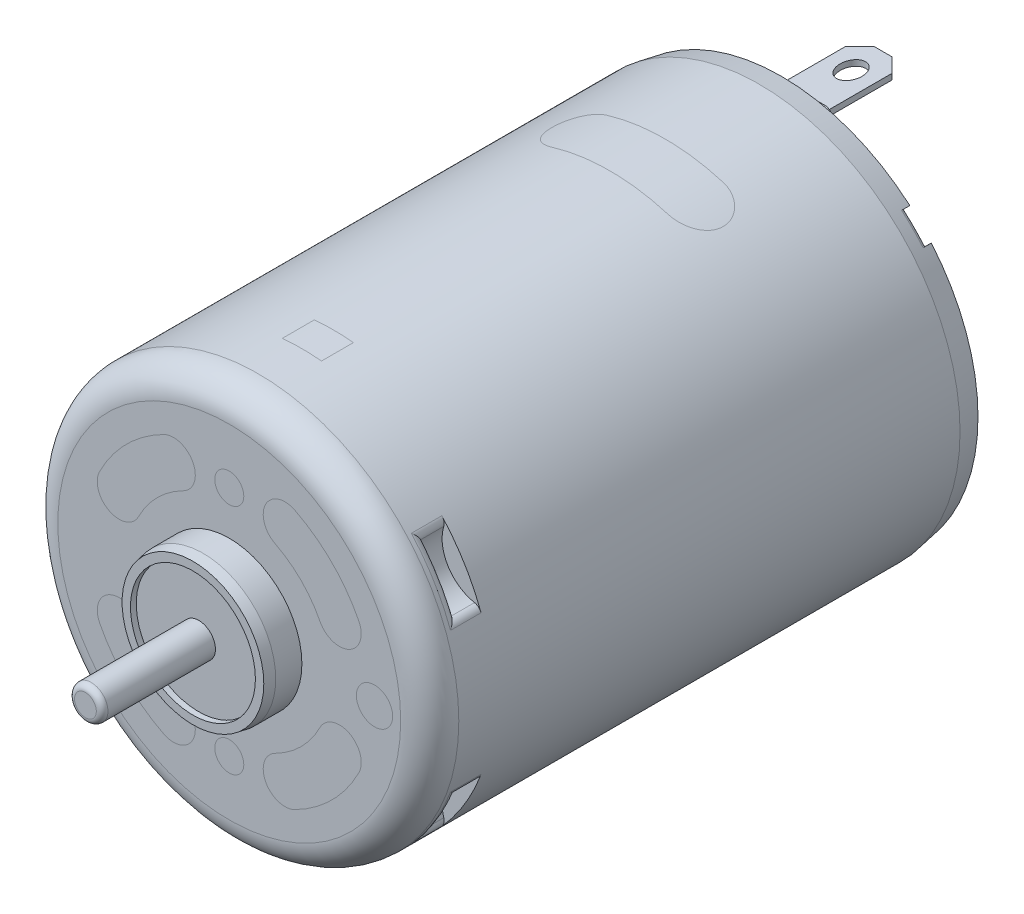
from build123d import *

# Parameters (mm, degrees)
SKETCH_1_R           = 13.8
EXTRUDE_1_DEPTH      = 38
SKETCH_2_R           = 9.6
EXTRUDE_2_DEPTH      = 0.3
CUT_EXTRUDE_START    = -0.5
SKETCH_3_R           = 13.2
SKETCH_3_R_2         = 9.6
CUT_EXTRUDE_1_DEPTH  = 0.5
FILLET_1_R           = 0.8
FILLET_2_R           = 2
SKETCH_4_R           = 5
EXTRUDE_3_DEPTH      = 2.5
SKETCH_5_R           = 1.15
EXTRUDE_4_DEPTH      = 7.4
FILLET_3_R           = 0.4
CUT_EXTRUDE_START_2  = -0.4
SKETCH_6_R           = 4.3
SKETCH_6_R_2         = 1.15
CUT_EXTRUDE_5_DEPTH  = 0.4
CHAMFER_1_SIZE       = 0.7
CHAMFER_1_SIZE2      = 0.123428886
CHAMFER_2_SIZE       = 1.5
CHAMFER_2_SIZE2      = 0.264490471
SKETCH_7_R           = 4.95
EXTRUDE_5_DEPTH      = 2.7
EXTRUDE_START        = 0.2
SKETCH_8_R           = 1.15
EXTRUDE_6_DEPTH      = 0.2
SKETCH_9_R           = 4.35
SKETCH_9_R_2         = 1.15
CUT_EXTRUDE_6_DEPTH  = 0.6
FILLET_4_R           = 0.4
SKETCH_14_W          = 5
SKETCH_14_H          = 2
EXTRUDE_7_DEPTH      = 1.5
FILLET_5_R           = 0.5
SKETCH_15_W          = 3.2
SKETCH_15_H          = 0.4
EXTRUDE_8_DEPTH      = 6
CHAMFER_3_SIZE       = 1
SKETCH_16_RX         = 1
SKETCH_16_RY         = 0.75
CUT_EXTRUDE_8_DEPTH  = 56.901162803
SKETCH_19_R          = 1.2
EXTRUDE_9_DEPTH      = 0.7
CHAMFER_4_SIZE       = 0.5
CHAMFER_5_SIZE       = 0.6
CHAMFER_5_SIZE2      = 0.105796188
SKETCH_20_R          = 2.75
CUT_EXTRUDE_9_DEPTH  = 1.5
FILLET_6_R           = 0.6
CUT_EXTRUDE_10_DEPTH = 0.4
FILLET_7_R           = 0.3


with BuildPart() as part:
    # ｽｹｯﾁ1 → ﾎﾞｽ - 押し出し1 (new body)
    with BuildSketch(Plane.XY):
        Circle(SKETCH_1_R)
    extrude(amount=EXTRUDE_1_DEPTH)

    # ｽｹｯﾁ2 → ﾎﾞｽ - 押し出し2 (add)
    with BuildSketch(Plane(origin=(0, 0, 0), x_dir=(-1, 0, 0), z_dir=(0, 0, -1))):
        with Locations(Location((0, 0, 0), (0, 0, 180))):
            Circle(SKETCH_2_R)
    extrude(amount=EXTRUDE_2_DEPTH)

    # ｽｹｯﾁ3 → ｶｯﾄ - 押し出し1 (cut)
    with BuildSketch(Plane(origin=(0, 0, 0), x_dir=(-1, 0, 0), z_dir=(0, 0, -1)).offset(CUT_EXTRUDE_START)):
        Circle(SKETCH_3_R)
        Circle(SKETCH_3_R_2, mode=Mode.SUBTRACT)
    extrude(amount=CUT_EXTRUDE_1_DEPTH, mode=Mode.SUBTRACT)

    # ﾌｨﾚｯﾄ1
    fillet_1_edges = [part.edges().sort_by_distance(p)[0] for p in [
        (-9.6, 0, -0.3),
    ]]
    fillet(fillet_1_edges, radius=FILLET_1_R - 0.0001)  # a hair under: the kernel refuses the full size

    # ﾌｨﾚｯﾄ2
    fillet_2_edges = [part.edges().sort_by_distance(p)[0] for p in [
        (-13.8, 0, 38),
    ]]
    fillet(fillet_2_edges, radius=FILLET_2_R)

    # ｽｹｯﾁ4 → ﾎﾞｽ - 押し出し3 (add)
    with BuildSketch(Plane.XY.offset(38)):
        Circle(SKETCH_4_R)
    extrude(amount=EXTRUDE_3_DEPTH)

    # ｽｹｯﾁ5 → ﾎﾞｽ - 押し出し4 (add)
    with BuildSketch(Plane.XY.offset(40.5)):
        Circle(SKETCH_5_R)
    extrude(amount=EXTRUDE_4_DEPTH)

    # ﾌｨﾚｯﾄ3
    fillet_3_edges = [part.edges().sort_by_distance(p)[0] for p in [
        (-1.15, 0, 47.9),
    ]]
    fillet(fillet_3_edges, radius=FILLET_3_R)

    # ｽｹｯﾁ6 → ｶｯﾄ - 押し出し5 (cut)
    with BuildSketch(Plane.XY.offset(40.5).offset(CUT_EXTRUDE_START_2)):
        Circle(SKETCH_6_R)
        Circle(SKETCH_6_R_2, mode=Mode.SUBTRACT)
    extrude(amount=CUT_EXTRUDE_5_DEPTH, mode=Mode.SUBTRACT)

    # 面取り1
    chamfer_1_edges = [part.edges().sort_by_distance(p)[0] for p in [
        (-5, 0, 40.5),
    ]]
    chamfer_1_side = [part.faces().sort_by_distance(p)[0] for p in [
        (-5, 0, 39.25),
    ]]
    chamfer(chamfer_1_edges, length=CHAMFER_1_SIZE, length2=CHAMFER_1_SIZE2, reference=chamfer_1_side[0])

    # 面取り2
    chamfer_2_edges = [part.edges().sort_by_distance(p)[0] for p in [
        (-13.8, 0, 0),
    ]]
    chamfer_2_side = [part.faces().sort_by_distance(p)[0] for p in [
        (-13.8, 0, 18),
    ]]
    chamfer(chamfer_2_edges, length=CHAMFER_2_SIZE, length2=CHAMFER_2_SIZE2, reference=chamfer_2_side[0])

    # ｽｹｯﾁ7 → ﾎﾞｽ - 押し出し5 (add)
    with BuildSketch(Plane(origin=(0, 0, -0.3), x_dir=(-1, 0, 0), z_dir=(0, 0, -1))):
        with Locations(Location((0, 0, 0), (0, 0, 180))):
            Circle(SKETCH_7_R)
    extrude(amount=EXTRUDE_5_DEPTH)

    # ｽｹｯﾁ8 → ﾎﾞｽ - 押し出し6 (add)
    with BuildSketch(Plane(origin=(0, 0, -3), x_dir=(-1, 0, 0), z_dir=(0, 0, -1)).offset(EXTRUDE_START)):
        with Locations(Location((0, 0, 0), (0, 0, 180))):
            Circle(SKETCH_8_R)
    extrude(amount=-EXTRUDE_6_DEPTH)

    # ｽｹｯﾁ9 → ｶｯﾄ - 押し出し6 (cut)
    with BuildSketch(Plane(origin=(0, 0, -3), x_dir=(-1, 0, 0), z_dir=(0, 0, -1))):
        Circle(SKETCH_9_R)
        with Locations(Location((0, 0, 0), (0, 0, 180))):
            Circle(SKETCH_9_R_2, mode=Mode.SUBTRACT)
    extrude(amount=-CUT_EXTRUDE_6_DEPTH, mode=Mode.SUBTRACT)

    # ﾌｨﾚｯﾄ4
    fillet_4_edges = [part.edges().sort_by_distance(p)[0] for p in [
        (-1.15, 0, -3.2),
    ]]
    fillet(fillet_4_edges, radius=FILLET_4_R)

    # ｽｹｯﾁ14 → ﾎﾞｽ - 押し出し7 (add)
    with BuildSketch(Plane(origin=(0, 0, 0.5), x_dir=(-1, 0, 0), z_dir=(0, 0, -1))):
        with Locations((0, -11.3)):
            Rectangle(SKETCH_14_W, SKETCH_14_H)
        with Locations((0, 11.3)):
            Rectangle(SKETCH_14_W, SKETCH_14_H)
    extrude(amount=EXTRUDE_7_DEPTH)

    # ﾌｨﾚｯﾄ5
    fillet_5_edges = [part.edges().sort_by_distance(p)[0] for p in [
        (-2.5, 10.3, -0.25),
        (-2.5, 12.3, -0.25),
        (2.5, 12.3, -0.25),
        (2.5, 10.3, -0.25),
        (-2.5, -10.3, -0.25),
        (2.5, -10.3, -0.25),
        (2.5, -12.3, -0.25),
        (-2.5, -12.3, -0.25),
    ]]
    fillet(fillet_5_edges, radius=FILLET_5_R)

    # ｽｹｯﾁ15 → ﾎﾞｽ - 押し出し8 (add)
    with BuildSketch(Plane(origin=(0, 0, -1), x_dir=(-1, 0, 0), z_dir=(0, 0, -1))):
        with Locations((0, 11.3)):
            Rectangle(SKETCH_15_W, SKETCH_15_H)
        with Locations((0, -11.3)):
            Rectangle(SKETCH_15_W, SKETCH_15_H)
    extrude(amount=EXTRUDE_8_DEPTH)

    # 面取り3
    chamfer_3_edges = [part.edges().sort_by_distance(p)[0] for p in [
        (-1.6, 11.3, -7),
        (1.6, 11.3, -7),
        (1.6, -11.3, -7),
        (-1.6, -11.3, -7),
    ]]
    chamfer(chamfer_3_edges, length=CHAMFER_3_SIZE)

    # ｽｹｯﾁ16 → ｶｯﾄ - 押し出し8 (cut, through all)
    with BuildSketch(Plane(origin=(0, 11.5, 0), x_dir=(1, 0, 0), z_dir=(0, 1, 0))):
        with Locations(Location((0, 4.8), (0, 0, 90))):
            Ellipse(SKETCH_16_RX, SKETCH_16_RY)
    extrude(amount=-CUT_EXTRUDE_8_DEPTH, mode=Mode.SUBTRACT)

    # ｽｹｯﾁ19 → ﾎﾞｽ - 押し出し9 (add)
    with BuildSketch(Plane(origin=(0, 0, 0.5), x_dir=(-1, 0, 0), z_dir=(0, 0, -1))):
        with Locations((-3.933231648, 10.806465139)):
            Circle(SKETCH_19_R)
        with Locations((6.669679799, 9.368317425)):
            Circle(SKETCH_19_R)
        with Locations((3.933231648, -10.806465139)):
            Circle(SKETCH_19_R)
        with Locations((-6.669679799, -9.368317425)):
            Circle(SKETCH_19_R)
    extrude(amount=EXTRUDE_9_DEPTH)

    # 面取り4
    chamfer_4_edges = [part.edges().sort_by_distance(p)[0] for p in [
        (-5.469679799, 9.368317425, -0.2),
        (-2.733231648, -10.806465139, -0.2),
        (7.869679799, -9.368317425, -0.2),
        (5.133231648, 10.806465139, -0.2),
    ]]
    chamfer(chamfer_4_edges, length=CHAMFER_4_SIZE)

    # 面取り5
    chamfer_5_edges = [part.edges().sort_by_distance(p)[0] for p in [
        (-4.95, 0, -3),
    ]]
    chamfer_5_side = [part.faces().sort_by_distance(p)[0] for p in [
        (-4.95, 0, -1.65),
    ]]
    chamfer(chamfer_5_edges, length=CHAMFER_5_SIZE, length2=CHAMFER_5_SIZE2, reference=chamfer_5_side[0])

    # ｽｹｯﾁ20 → ｶｯﾄ - 押し出し9 (cut)
    with BuildSketch(Plane.XY.offset(35.1)):
        with Locations((-13, 7.9)):
            Circle(SKETCH_20_R)
        with Locations((13, 7.9)):
            Circle(SKETCH_20_R)
        with Locations((13, -7.9)):
            Circle(SKETCH_20_R)
        with Locations((-13, -7.9)):
            Circle(SKETCH_20_R)
    extrude(amount=-CUT_EXTRUDE_9_DEPTH, mode=Mode.SUBTRACT)

    # ﾌｨﾚｯﾄ6
    fillet_6_edges = [part.edges().sort_by_distance(p)[0] for p in [
        (-11.793192227, 7.1666322, 35.1),
        (-12.800098139, 5.157275215, 34.35),
        (-10.473474741, 8.985895996, 34.35),
        (-11.793192227, -7.1666322, 35.1),
        (-10.473474741, -8.985895996, 34.35),
        (-12.800098139, -5.157275215, 34.35),
        (11.793192227, -7.1666322, 35.1),
        (12.800098139, -5.157275215, 34.35),
        (10.473474741, -8.985895996, 34.35),
        (11.793192227, 7.1666322, 35.1),
        (10.473474741, 8.985895996, 34.35),
        (12.800098139, 5.157275215, 34.35),
    ]]
    fillet(fillet_6_edges, radius=FILLET_6_R)

    # ｽｹｯﾁ21 → ｶｯﾄ - 押し出し10 (cut)
    with BuildSketch(Plane(origin=(0, 0, 0), x_dir=(-1, 0, 0), z_dir=(0, 0, -1))):
        Polygon((9.140645343, 10.541271546), (8.604728986, 10.009927027), (10.083278673, 8.518655481), (10.61919503, 9.05), align=None)
        Polygon((-10.61919503, 9.05), (-10.083278673, 8.518655481), (-8.604728986, 10.009927027), (-9.140645343, 10.541271546), align=None)
        Polygon((9.140645343, -10.541271546), (8.604728986, -10.009927027), (10.083278673, -8.518655481), (10.61919503, -9.05), align=None)
        Polygon((-9.140645343, -10.541271546), (-8.604728986, -10.009927027), (-10.083278673, -8.518655481), (-10.61919503, -9.05), align=None)
    extrude(amount=-CUT_EXTRUDE_10_DEPTH, mode=Mode.SUBTRACT)

    # ﾌｨﾚｯﾄ7
    fillet_7_edges = [part.edges().sort_by_distance(p)[0] for p in [
        (-9.662047991, 9.579622219, 0.4),
        (9.662047991, -9.579622219, 0.4),
        (-9.662047991, -9.579622219, 0.4),
        (9.662047991, 9.579622219, 0.4),
    ]]
    fillet(fillet_7_edges, radius=FILLET_7_R)


solid = part.part
